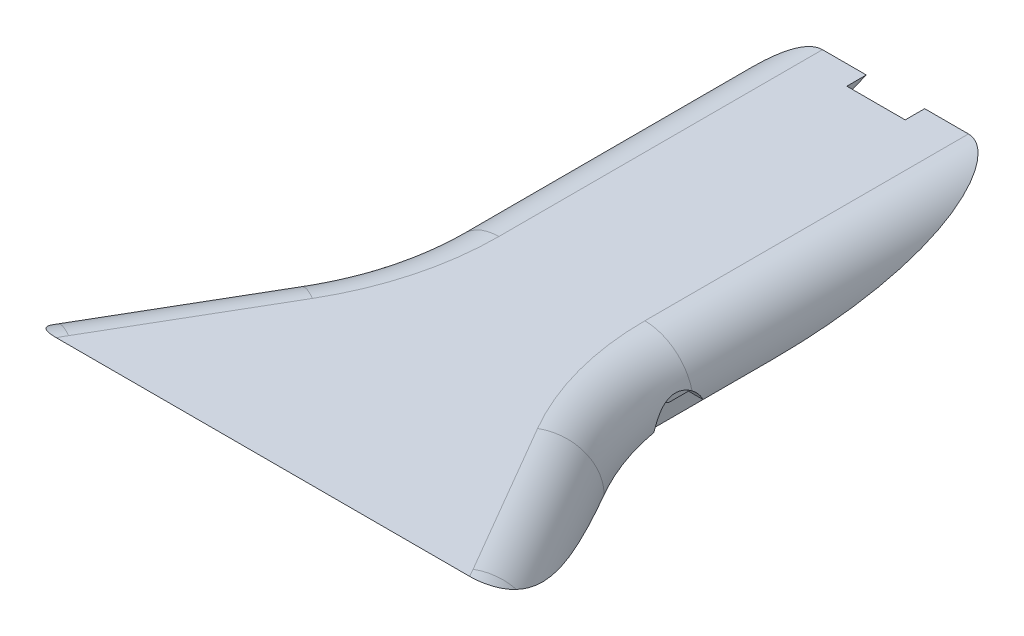
from build123d import *

# Parameters (mm, degrees)
EXTRUDE_1_DEPTH           = 20
SKETCH_2_R                = 4
CUT_EXTRUDE_1_DEPTH       = 52
FILLET_1_R                = 25
FILLET_2_R                = 5
FILLET_3_R                = 10
SKETCH_4_W                = 8
SKETCH_4_H                = 8
CUT_EXTRUDE_2_DEPTH       = 5
CUT_EXTRUDE_START         = -57
SKETCH_4_2_W              = 8
SKETCH_4_2_H              = 8
CUT_EXTRUDE_3_DEPTH       = 5
SKETCH_5_W                = 15
SKETCH_5_H                = 5
CUT_EXTRUDE_4_DEPTH       = 7.5
SKETCH_6_R                = 1.45
CUT_EXTRUDE_5_DEPTH       = 10
CUT_EXTRUDE_6_DEPTH       = 7
SKETCH_9_R                = 1.45
CUT_EXTRUDE_7_DEPTH       = 90
CUT_EXTRUDE_8_DEPTH       = 116.378724321
CUT_EXTRUDE_8_DEPTH_BACK  = 116.378724321
SKETCH_10_W               = 136.912738892
SKETCH_10_H               = 37.062753894
SKETCH_11_W               = 2.5
SKETCH_11_H               = 20
EXTRUDE_2_DEPTH           = 3
CUT_EXTRUDE_9_DEPTH       = 110.555003156
CUT_EXTRUDE_9_DEPTH_BACK  = 110.555003156
SKETCH_12_R               = 1.45
CUT_EXTRUDE_10_DEPTH      = 110.555003156
CUT_EXTRUDE_10_DEPTH_BACK = 1.5
CUT_EXTRUDE_10_START      = 3
SKETCH_13_R               = 3
CUT_EXTRUDE_11_DEPTH      = 1.5
CUT_EXTRUDE_11_DEPTH_BACK = 110.555003156
CUT_EXTRUDE_11_START      = -22
SKETCH_13_2_R             = 3
SKETCH_14_W               = 6
SKETCH_14_H               = 2
CUT_EXTRUDE_12_DEPTH      = 1.5


with BuildPart() as part:
    # Эскиз1 → Бобышка-Вытянуть1 (new body)
    with BuildSketch(Plane(origin=(0, 0, 0), x_dir=(1, 0, 0), z_dir=(0, 1, 0))):
        Polygon((21, 25), (-21, 25), (-21, 0), (-28.5, 0), (-28.5, 35), (-12.5, 62.5), (-12.5, 110), (12.5, 110), (12.5, 62.5), (28.5, 35), (28.5, 0), (21, 0), align=None)
    extrude(amount=EXTRUDE_1_DEPTH)

    # Эскиз2 → Вырез-Вытянуть1 (cut)
    with BuildSketch(Plane(origin=(28.5, 0, 0), x_dir=(0, 0, -1), z_dir=(1, 0, 0))):
        with Locations((10, 10)):
            Circle(SKETCH_2_R)
    extrude(amount=-CUT_EXTRUDE_1_DEPTH, mode=Mode.SUBTRACT)

    # Скругление1
    fillet_1_edges = [part.edges().sort_by_distance(p)[0] for p in [
        (28.5, 10, -35),
        (-28.5, 10, -35),
        (-12.5, 10, -62.5),
        (12.5, 10, -62.5),
    ]]
    fillet(fillet_1_edges, radius=FILLET_1_R)

    # Скругление2
    fillet_2_edges = [part.edges().sort_by_distance(p)[0] for p in [
        (28.5, 0, -14.128221453),
        (24.75, 0, 0),
        (-24.75, 0, 0),
        (-12.5, 0, -89.621778547),
        (-12.5, 20, -89.621778547),
        (28.5, 10, 0),
        (-28.5, 10, 0),
        (-24.75, 20, 0),
        (24.75, 20, 0),
        (-28.5, 0, -14.128221453),
        (-28.5, 20, -14.128221453),
        (20.5, 0, -48.75),
        (-20.5, 0, -48.75),
        (12.5, 0, -89.621778547),
        (27.637291802, 0, -34.76729112),
        (-27.637291802, 0, -34.76729112),
        (28.5, 20, -14.128221453),
        (-20.5, 20, -48.75),
        (20.5, 20, -48.75),
        (12.5, 20, -89.621778547),
        (27.637291802, 20, -34.76729112),
        (-27.637291802, 20, -34.76729112),
        (-13.362708198, 0, -62.73270888),
        (-13.362708198, 20, -62.73270888),
        (13.362708198, 0, -62.73270888),
        (13.362708198, 20, -62.73270888),
    ]]
    fillet(fillet_2_edges, radius=FILLET_2_R)

    # Скругление3
    fillet_3_edges = [part.edges().sort_by_distance(p)[0] for p in [
        (0, 0, -25),
        (0, 20, -25),
    ]]
    fillet(fillet_3_edges, radius=FILLET_3_R - 0.0001)  # a hair under: the kernel refuses the full size

    # Эскиз4 → Вырез-Вытянуть2 (cut)
    with BuildSketch(Plane(origin=(28.5, 0, 0), x_dir=(0, 0, -1), z_dir=(1, 0, 0))):
        with Locations((10, 10)):
            Rectangle(SKETCH_4_W, SKETCH_4_H)
    extrude(amount=-CUT_EXTRUDE_2_DEPTH, mode=Mode.SUBTRACT)

    # Эскиз4<2> → Вырез-Вытянуть3 (cut)
    with BuildSketch(Plane(origin=(28.5, 0, 0), x_dir=(0, 0, -1), z_dir=(1, 0, 0)).offset(CUT_EXTRUDE_START)):
        with Locations((10, 10)):
            Rectangle(SKETCH_4_2_W, SKETCH_4_2_H)
    extrude(amount=CUT_EXTRUDE_3_DEPTH, mode=Mode.SUBTRACT)

    # Эскиз5 → Вырез-Вытянуть4 (cut)
    with BuildSketch(Plane(origin=(0, 0, -110), x_dir=(-1, 0, 0), z_dir=(0, 0, -1))):
        with Locations((0, 17.5)):
            Rectangle(SKETCH_5_W, SKETCH_5_H)
        with Locations((0, 2.5)):
            Rectangle(SKETCH_5_W, SKETCH_5_H)
    extrude(amount=-CUT_EXTRUDE_4_DEPTH, mode=Mode.SUBTRACT)

    # Эскиз6 → Вырез-Вытянуть5 (cut)
    with BuildSketch(Plane(origin=(0, 15, 0), x_dir=(1, 0, 0), z_dir=(0, 1, 0))):
        with Locations(Location((-4, 106.25, 0), (0, 0, 270))):
            Circle(SKETCH_6_R)
        with Locations(Location((4, 106.25, 0), (0, 0, 90))):
            Circle(SKETCH_6_R)
    extrude(amount=-CUT_EXTRUDE_5_DEPTH, mode=Mode.SUBTRACT)

    # Эскиз8 → Вырез-Вытянуть6 (cut, symmetric)
    with BuildSketch(Plane(origin=(0, 0, 0), x_dir=(0, 0, -1), z_dir=(1, 0, 0))):
        with BuildLine():
            Line((102.5, 18), (37.5, 18))
            ThreePointArc((37.5, 18), (29.5, 10), (37.5, 2))
            Line((37.5, 2), (102.5, 2))
            Line((102.5, 2), (102.5, 18))
        make_face()
    extrude(amount=CUT_EXTRUDE_6_DEPTH, both=True, mode=Mode.SUBTRACT)

    # Эскиз9 → Вырез-Вытянуть7 (cut)
    with BuildSketch(Plane(origin=(0, 0, -110), x_dir=(-1, 0, 0), z_dir=(0, 0, -1))):
        with Locations((-10, 10)):
            Circle(SKETCH_9_R)
        with Locations((10, 10)):
            Circle(SKETCH_9_R)
    extrude(amount=-CUT_EXTRUDE_7_DEPTH, mode=Mode.SUBTRACT)

    # Эскиз10 → Вырез-Вытянуть8 (cut, two sides: drawn at the far end of the back side and taken through both)
    with BuildSketch(Plane(origin=(0, 0, 0), x_dir=(0, 0, -1), z_dir=(1, 0, 0)).offset(-CUT_EXTRUDE_8_DEPTH_BACK)):
        with Locations((61.52396192, 11.158211059)):
            Rectangle(SKETCH_10_W, SKETCH_10_H)
        with BuildLine():
            Line((37.5, 20), (102.5, 20))
            ThreePointArc((102.5, 20), (90.247548784, 16.26225608), (77.5, 15))
            Line((77.5, 15), (57.5, 15))
            ThreePointArc((57.5, 15), (47.192235936, 16.268943744), (37.5, 20))
        make_face(mode=Mode.SUBTRACT)
    extrude(amount=CUT_EXTRUDE_8_DEPTH + CUT_EXTRUDE_8_DEPTH_BACK, mode=Mode.SUBTRACT)

    # Эскиз11 → Бобышка-Вытянуть2 (add)
    with BuildSketch(Plane.XZ.offset(-15)):
        with Locations((8.25, -67.5)):
            Rectangle(SKETCH_11_W, SKETCH_11_H)
        with Locations((-8.25, -67.5)):
            Rectangle(SKETCH_11_W, SKETCH_11_H)
    extrude(amount=EXTRUDE_2_DEPTH)

    # Эскиз12 → Вырез-Вытянуть9 (cut, two sides: drawn at the far end of the back side and taken through both)
    with BuildSketch(Plane(origin=(9.5, 0, 0), x_dir=(0, 0, -1), z_dir=(1, 0, 0)).offset(-CUT_EXTRUDE_9_DEPTH_BACK)):
        with Locations(Location((67.5, 13.75, 0), (0, 0, 59.549685979))):
            Circle(SKETCH_12_R)
    extrude(amount=CUT_EXTRUDE_9_DEPTH + CUT_EXTRUDE_9_DEPTH_BACK, mode=Mode.SUBTRACT)

    # Эскиз13 → Вырез-Вытянуть10 (cut, two sides: drawn at the far end of the back side and taken through both)
    with BuildSketch(Plane(origin=(9.5, 0, 0), x_dir=(0, 0, -1), z_dir=(1, 0, 0)).offset(CUT_EXTRUDE_10_START - CUT_EXTRUDE_10_DEPTH_BACK)):
        with Locations((67.5, 13.75)):
            Circle(SKETCH_13_R)
    extrude(amount=CUT_EXTRUDE_10_DEPTH + CUT_EXTRUDE_10_DEPTH_BACK, mode=Mode.SUBTRACT)

    # Эскиз13<2> → Вырез-Вытянуть11 (cut, two sides: drawn at the far end of the back side and taken through both)
    with BuildSketch(Plane(origin=(9.5, 0, 0), x_dir=(0, 0, -1), z_dir=(1, 0, 0)).offset(CUT_EXTRUDE_11_START - CUT_EXTRUDE_11_DEPTH_BACK)):
        with Locations((67.5, 13.75)):
            Circle(SKETCH_13_2_R)
    extrude(amount=CUT_EXTRUDE_11_DEPTH + CUT_EXTRUDE_11_DEPTH_BACK, mode=Mode.SUBTRACT)

    # Эскиз14 → Вырез-Вытянуть12 (cut)
    with BuildSketch(Plane(origin=(0, 20, 0), x_dir=(1, 0, 0), z_dir=(0, 1, 0))):
        with Locations((0, 101.5)):
            Rectangle(SKETCH_14_W, SKETCH_14_H)
    extrude(amount=-CUT_EXTRUDE_12_DEPTH, mode=Mode.SUBTRACT)


solid = part.part
